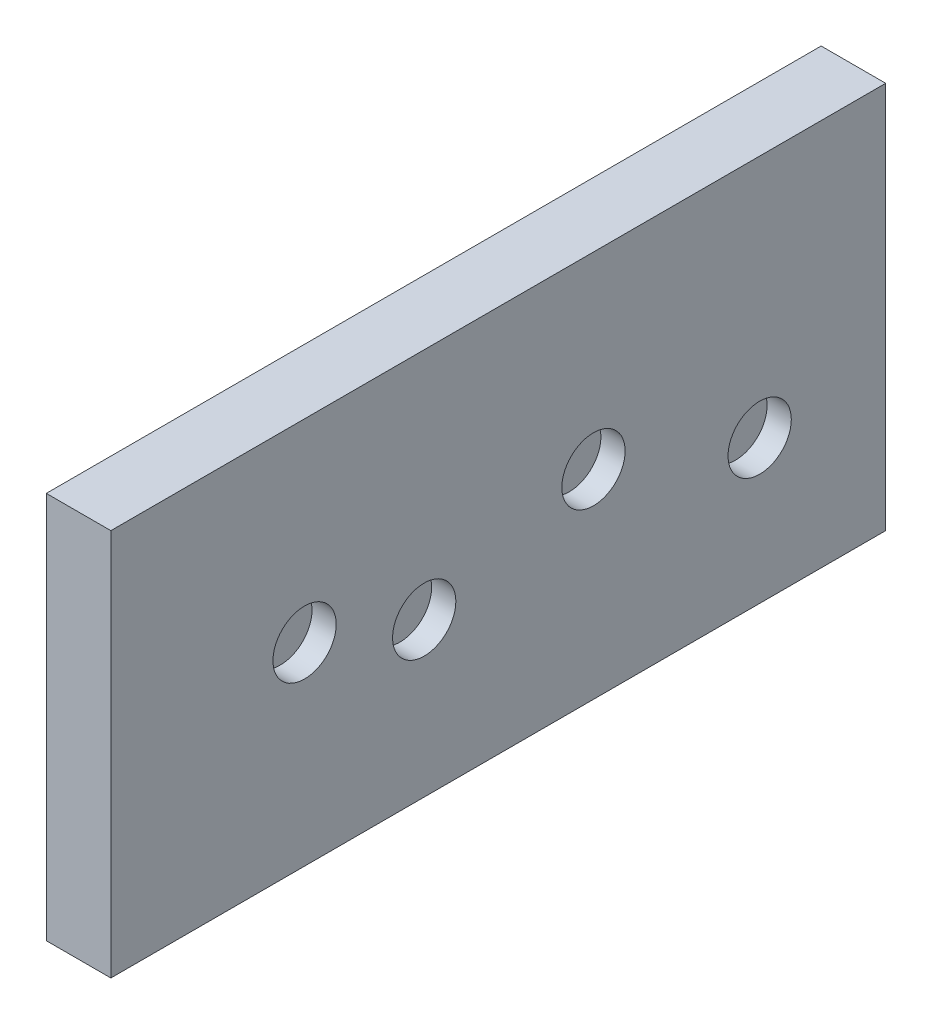
from build123d import *

# Parameters (mm, degrees)
SKETCH1_W           = 152.4
SKETCH1_H           = 76.2
BOSS_EXTRUDE1_DEPTH = 12.7
SKETCH2_R           = 6.223
CUT_EXTRUDE1_DEPTH  = 4.7625


with BuildPart() as part:
    # Sketch1 → Boss-Extrude1 (new body)
    with BuildSketch(Plane(origin=(0, 0, 0), x_dir=(0, 0, -1), z_dir=(1, 0, 0))):
        Rectangle(SKETCH1_W, SKETCH1_H)
    extrude(amount=BOSS_EXTRUDE1_DEPTH)

    # Sketch2 → Cut-Extrude1 (cut)
    with BuildSketch(Plane.ZY.offset(-12.7)):
        with Locations((38.1, 0)):
            Circle(SKETCH2_R)
        with Locations((14.571224015, -7.860160654)):
            Circle(SKETCH2_R)
        with Locations((-18.72253158, 1.096077429)):
            Circle(SKETCH2_R)
        with Locations((-51.408255992, -9.873506971)):
            Circle(SKETCH2_R)
    extrude(amount=CUT_EXTRUDE1_DEPTH, mode=Mode.SUBTRACT)


solid = part.part
